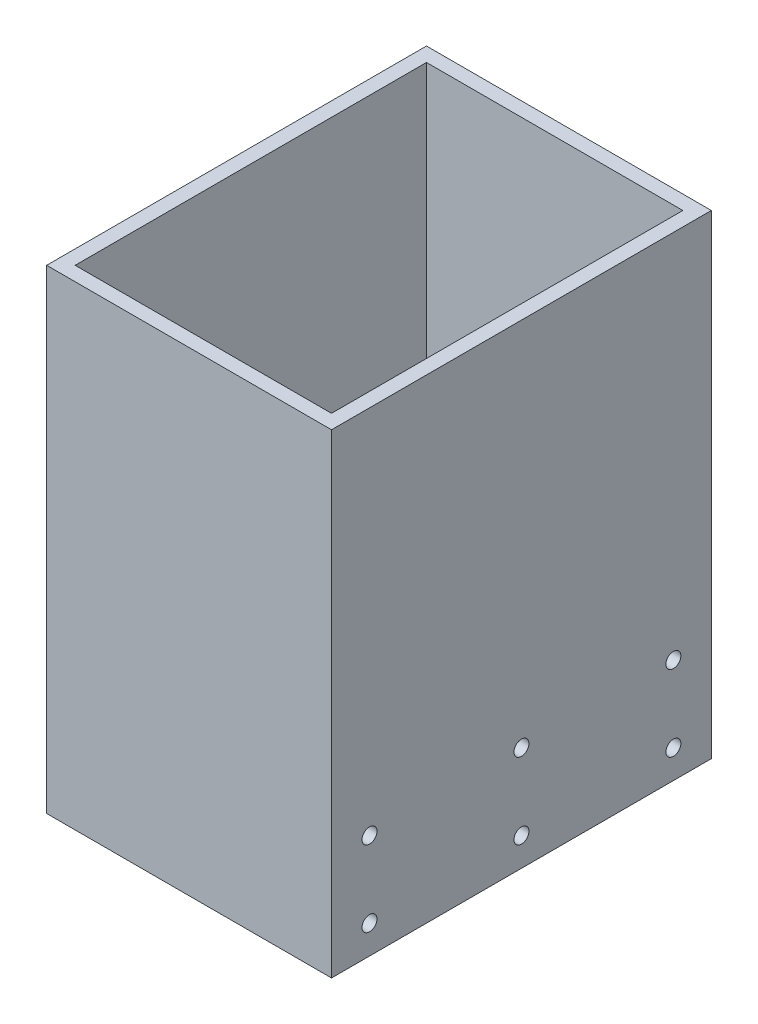
from build123d import *

# Parameters (mm, degrees)
SKETCH1_W                    = 60
SKETCH1_H                    = 80
SKETCH1_W_2                  = 54
SKETCH1_H_2                  = 74
BOSS_EXTRUDE1_DEPTH          = 100
TAP_DRILL_FOR_M3_HELICOIL2_D = 3.15


with BuildPart() as part:
    # Sketch1 → Boss-Extrude1 (new body)
    with BuildSketch(Plane(origin=(0, 0, 0), x_dir=(1, 0, 0), z_dir=(0, 1, 0))):
        with Locations((30, 40)):
            Rectangle(SKETCH1_W, SKETCH1_H)
        with Locations((30, 40)):
            Rectangle(SKETCH1_W_2, SKETCH1_H_2, mode=Mode.SUBTRACT)
    extrude(amount=BOSS_EXTRUDE1_DEPTH)

    # Tap Drill for M3 Helicoil2 (through all)
    with Locations(Plane.ZY):
        with Locations((-8, 6), (-40, 6), (-72, 6), (-40, 22), (-72, 22), (-8, 22)):
            Hole(TAP_DRILL_FOR_M3_HELICOIL2_D / 2)


solid = part.part
